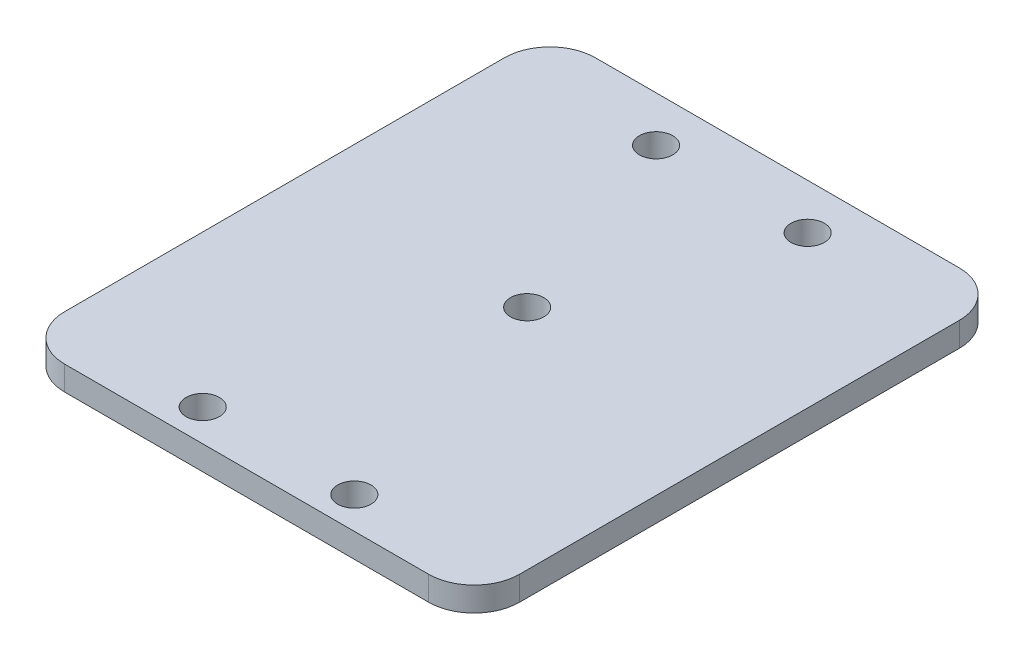
from build123d import *

# Parameters (mm, degrees)
SKETCH1_W                = 30
SKETCH1_H                = 35
BOSS_EXTRUDE1_DEPTH      = 1.6
CUT_EXTRUDE3_DEPTH       = 0.001
M2_CLEARANCE_HOLE1_D     = 2.2
M2_CLEARANCE_HOLE1_DEPTH = 5.2
M2_CLEARANCE_HOLE1_TIP   = 0.660946681
FILLET2_R                = 3


with BuildPart() as part:
    # Sketch1 → Boss-Extrude1 (new body)
    with BuildSketch(Plane(origin=(0, 0, 0), x_dir=(1, 0, 0), z_dir=(0, 1, 0))):
        Rectangle(SKETCH1_W, SKETCH1_H)
    extrude(amount=BOSS_EXTRUDE1_DEPTH)

    # Sketch5 → Cut-Extrude3 (cut)
    with BuildSketch(Plane.XZ):
        with BuildLine():
            Line((7, 17.5), (3, 17.5))
            Line((3, 17.5), (3, 5))
            ThreePointArc((3, 5), (2.267766953, 3.232233047), (0.5, 2.5))
            Line((0.5, 2.5), (-0.5, 2.5))
            ThreePointArc((-0.5, 2.5), (-2.267766953, 3.232233047), (-3, 5))
            Line((-3, 5), (-3, 17.5))
            Line((-3, 17.5), (-7, 17.5))
            Line((-7, 17.5), (-7, -17.5))
            Line((-7, -17.5), (-3, -17.5))
            Line((-3, -17.5), (-3, -7))
            ThreePointArc((-3, -7), (-2.267766953, -5.232233047), (-0.5, -4.5))
            Line((-0.5, -4.5), (0.5, -4.5))
            ThreePointArc((0.5, -4.5), (2.267766953, -5.232233047), (3, -7))
            Line((3, -7), (3, -17.5))
            Line((3, -17.5), (7, -17.5))
            Line((7, -17.5), (7, 17.5))
        make_face()
    extrude(amount=-CUT_EXTRUDE3_DEPTH, mode=Mode.SUBTRACT)

    # M2 Clearance Hole1
    with Locations(Plane(origin=(0, 1.6, 0), x_dir=(1, 0, 0), z_dir=(0, 1, 0))):
        with Locations((-5, 14.5), (-5, -15.4), (5, -15.4), (5, 14.5), (0, 1)):
            Hole(M2_CLEARANCE_HOLE1_D / 2, depth=M2_CLEARANCE_HOLE1_DEPTH)
            with Locations((0, 0, -(M2_CLEARANCE_HOLE1_DEPTH + M2_CLEARANCE_HOLE1_TIP / 2))):  # 118° drill point
                Cone(0, M2_CLEARANCE_HOLE1_D / 2, M2_CLEARANCE_HOLE1_TIP, mode=Mode.SUBTRACT)

    # Fillet2
    fillet2_edges = [part.edges().sort_by_distance(p)[0] for p in [
        (15, 0.8, 17.5),
        (-15, 0.8, 17.5),
        (-15, 0.8, -17.5),
        (15, 0.8, -17.5),
    ]]
    fillet(fillet2_edges, radius=FILLET2_R)


solid = part.part
